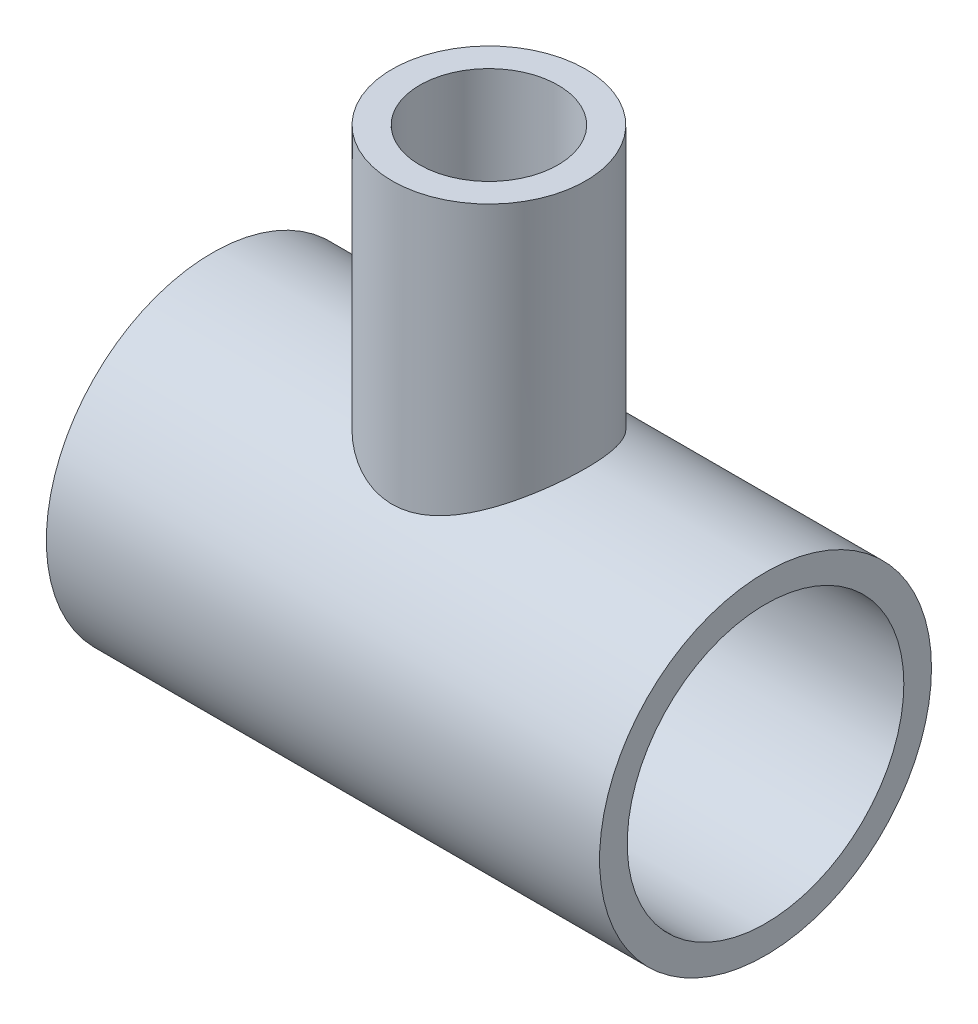
from build123d import *

# Parameters (mm, degrees)
SKETCH1_R           = 7.62
BOSS_EXTRUDE1_DEPTH = 25.4
SKETCH2_R           = 4.445
BOSS_EXTRUDE2_DEPTH = 19.05
SKETCH3_R           = 6.35
CUT_EXTRUDE1_DEPTH  = 33.651598895
CUT_EXTRUDE2_REACH  = 39.61
SKETCH4_R           = 3.175


with BuildPart() as part:
    # Sketch1 → Boss-Extrude1 (new body)
    with BuildSketch(Plane(origin=(0, 0, 0), x_dir=(0, 0, -1), z_dir=(1, 0, 0))):
        Circle(SKETCH1_R)
    extrude(amount=BOSS_EXTRUDE1_DEPTH)

    # Sketch2 → Boss-Extrude2 (add)
    with BuildSketch(Plane(origin=(0, 0, 0), x_dir=(1, 0, 0), z_dir=(0, 1, 0))):
        with Locations((12.7, 0)):
            Circle(SKETCH2_R)
    extrude(amount=BOSS_EXTRUDE2_DEPTH)

    # Sketch3 → Cut-Extrude1 (cut, through all)
    with BuildSketch(Plane(origin=(25.4, 0, 0), x_dir=(0, 0, -1), z_dir=(1, 0, 0))):
        Circle(SKETCH3_R)
    extrude(amount=-CUT_EXTRUDE1_DEPTH, mode=Mode.SUBTRACT)

    # Sketch4 → Cut-Extrude2 (cut, up to next)
    with BuildSketch(Plane(origin=(0, 19.05, 0), x_dir=(1, 0, 0), z_dir=(0, 1, 0)), mode=Mode.PRIVATE) as cut_extrude2_sk1:
        with Locations((12.7, 0)):
            Circle(SKETCH4_R)
    cut_extrude2_tool1 = extrude(cut_extrude2_sk1.sketch, amount=-CUT_EXTRUDE2_REACH, mode=Mode.PRIVATE) & part.part
    add(cut_extrude2_tool1.solids().sort_by_distance((12.7, 19.05, 0))[0], mode=Mode.SUBTRACT)


solid = part.part
